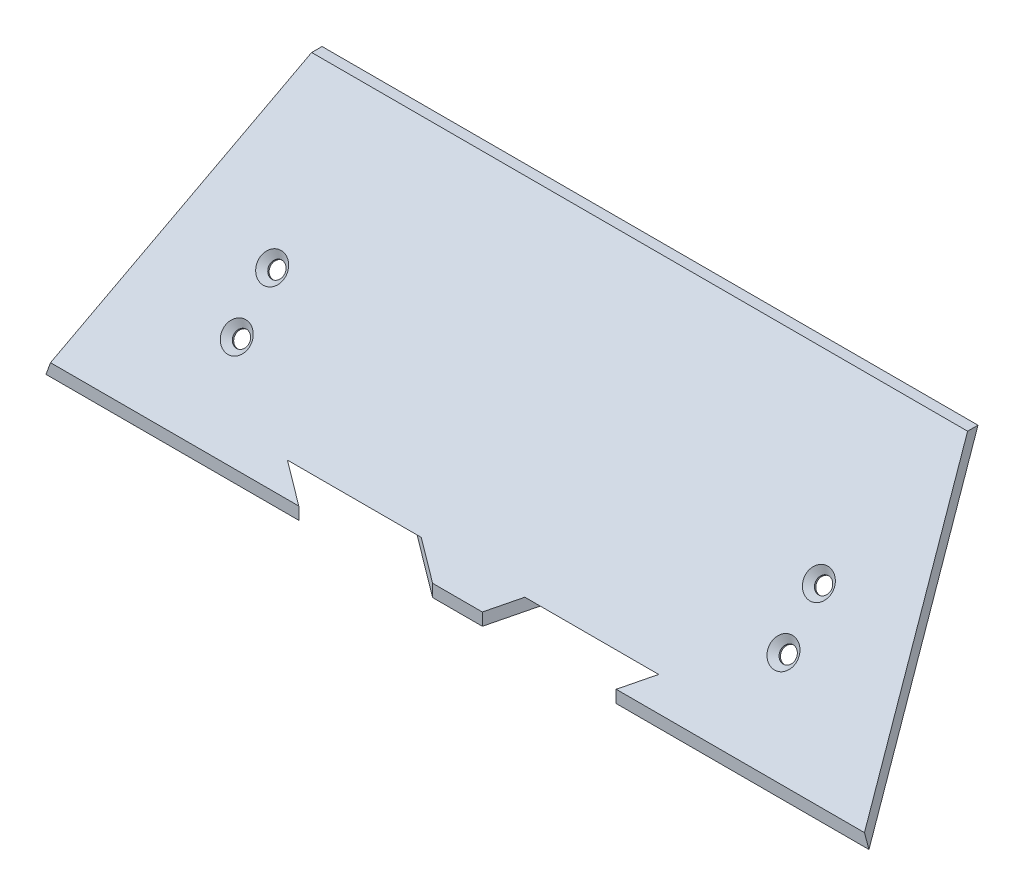
from build123d import *

# Parameters (mm, degrees)
BOSS_EXTRUDE1_DEPTH                             = 186.947944
CUT_EXTRUDE1_DEPTH                              = 202.219677631
CUT_EXTRUDE2_DEPTH                              = 119.891891944
CSK_FOR_M3_FLAT_HEAD_MACHINE_SCREW1_D           = 3.5
CSK_FOR_M3_FLAT_HEAD_MACHINE_SCREW1_DEPTH       = 5
CSK_FOR_M3_FLAT_HEAD_MACHINE_SCREW1_CSINK_D     = 6.3
CSK_FOR_M3_FLAT_HEAD_MACHINE_SCREW1_CSINK_ANGLE = 90
CUT_EXTRUDE3_REACH                              = 142.174
SKETCH7_W                                       = 15.2
SKETCH7_H                                       = 8


with BuildPart() as part:
    # Sketch2 → Boss-Extrude1 (new body)
    with BuildSketch(Plane(origin=(0, 0, 0), x_dir=(0, 0, -1), z_dir=(1, 0, 0))):
        Polygon((0, 0), (-2.3622, 0), (45.480481789, 57.016687901), (47.842681789, 57.016687901), align=None)
    extrude(amount=BOSS_EXTRUDE1_DEPTH)

    # Sketch3 → Cut-Extrude1 (cut, through all)
    with BuildSketch(Plane.ZY):
        Polygon((-4.105707607, 4.89299179), (-4.105707607, 7.708152127), (2.3622, 0), (0, 0), align=None)
    extrude(amount=-CUT_EXTRUDE1_DEPTH, mode=Mode.SUBTRACT)

    # Sketch4 → Cut-Extrude2 (cut, through all)
    with BuildSketch(Plane(origin=(93.496468894, -1.981357522, -4.105707607), x_dir=(-1, 0, 0), z_dir=(0, 0, -1))):
        Polygon((93.496468894, 58.998045423), (74.524995009, 58.998045423), (93.496468894, 6.874349312), align=None)
        Polygon((-93.451475106, 6.874349312), (-93.451475106, 58.998045423), (-74.480001222, 58.998045423), align=None)
    extrude(amount=CUT_EXTRUDE2_DEPTH, mode=Mode.SUBTRACT)

    # CSK for M3 Flat Head Machine Screw1
    with Locations(Plane(origin=(0, 1.163156437, 1.386195863), x_dir=(1, 0, 0), z_dir=(0, 0.6427876096865436, 0.7660444431189746))):
        with Locations((31.377677493, 39.65493708), (31.377677493, 27.145498062)):
            csk_for_m3_flat_head_machine_screw1 = CounterSinkHole(CSK_FOR_M3_FLAT_HEAD_MACHINE_SCREW1_D / 2, CSK_FOR_M3_FLAT_HEAD_MACHINE_SCREW1_CSINK_D / 2, depth=CSK_FOR_M3_FLAT_HEAD_MACHINE_SCREW1_DEPTH, counter_sink_angle=CSK_FOR_M3_FLAT_HEAD_MACHINE_SCREW1_CSINK_ANGLE)

    # Mirror1: CSK for M3 Flat Head Machine Screw1 across plane
    add(csk_for_m3_flat_head_machine_screw1.mirror(Plane(origin=(93.473972, 0, 0), x_dir=(0, 0, 1), z_dir=(1, 0, 0))), mode=Mode.SUBTRACT)

    # Cut-Extrude3: up to this plane
    cut_extrude3_end = Plane(origin=(186.947944, 0, 2.3622), z_dir=(0, -0.6427876096865434, -0.7660444431189748))
    # Sketch7 → Cut-Extrude3 (cut, up to the surface)
    with BuildSketch(Plane(origin=(112.633038957, 0, -65.028715361), x_dir=(0.4999999999999981, -1.9080601945838373e-15, 0.8660254037844397), z_dir=(-0.8660254037844397, 3.3048572009189827e-15, 0.4999999999999981)), mode=Mode.PRIVATE) as cut_extrude3_sk1:
        with Locations((53.60637797, 7.918642478)):
            Rectangle(SKETCH7_W, SKETCH7_H)
    cut_extrude3_tool1 = split(extrude(cut_extrude3_sk1.sketch, amount=CUT_EXTRUDE3_REACH, mode=Mode.PRIVATE), bisect_by=cut_extrude3_end, keep=Keep.BOTH, mode=Mode.PRIVATE)
    cut_extrude3 = cut_extrude3_tool1.solids().sort_by_distance((139.436228, 7.918642, -18.60423))[0]
    add(cut_extrude3, mode=Mode.SUBTRACT)

    # Mirror2: Cut-Extrude3 across plane
    add(cut_extrude3.mirror(Plane(origin=(93.473972, 0, 0), x_dir=(0, 0, 1), z_dir=(1, 0, 0))), mode=Mode.SUBTRACT)


solid = part.part
